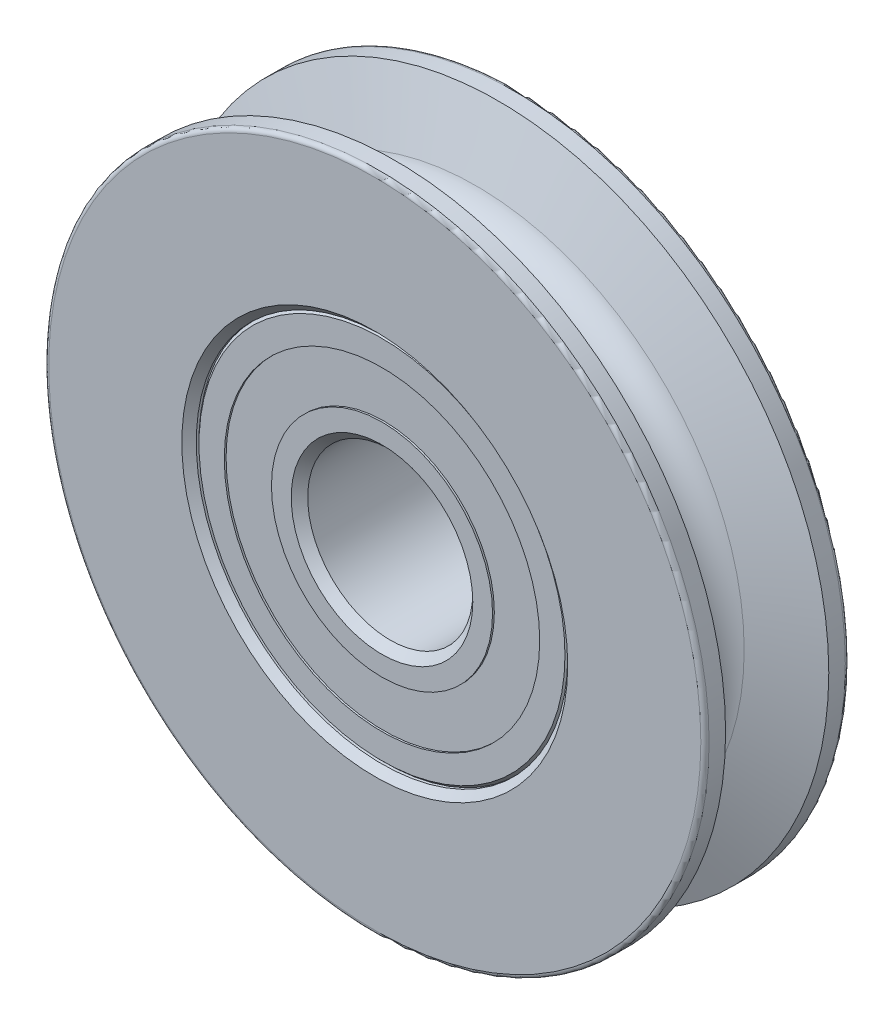
from build123d import *

# Parameters (mm, degrees)
BEARING_BALL_CIRPATTERN_COUNT = 11


with BuildPart() as part:
    # Sketch2 → Bushing Revolve1 (revolve)
    with BuildSketch(Plane(origin=(0, 0, 0), x_dir=(0, 0, -1), z_dir=(1, 0, 0))):
        with BuildLine():
            Line((-5.000625, 7.62), (-5.000625, 6.985))
            Line((-5.000625, 6.985), (-4.365625, 6.35))
            Line((-4.365625, 6.35), (4.683125, 6.35))
            Line((4.683125, 6.35), (5.000625, 6.6675))
            Line((5.000625, 6.6675), (5.000625, 8.504464286))
            Line((5.000625, 8.504464286), (1.360714286, 8.504464286))
            ThreePointArc((1.360714286, 8.504464286), (0.717159398, 8.167271806), (0, 8.050892857))
            Line((0, 8.050892857), (0, 6.985))
            Line((0, 6.985), (-4.365625, 6.985))
            Line((-4.365625, 6.985), (-5.000625, 7.62))
        make_face()
    revolve(axis=Axis((0, 0, 5.000625), (0, 0, -1)))



with BuildPart() as body_2:
    # Sketch3 → Bushing Revolve2 (revolve)
    with BuildSketch(Plane(origin=(0, 0, 0), x_dir=(0, 0, -1), z_dir=(1, 0, 0))):
        with BuildLine():
            Line((-5.000625, 8.504464286), (-5.000625, 7.62))
            Line((-5.000625, 7.62), (-4.365625, 6.985))
            Line((-4.365625, 6.985), (0, 6.985))
            Line((0, 6.985), (0, 8.050892857))
            ThreePointArc((0, 8.050892857), (-0.717159398, 8.167271806), (-1.360714286, 8.504464286))
            Line((-1.360714286, 8.504464286), (-5.000625, 8.504464286))
        make_face()
    revolve(axis=Axis((0, 0, 5.000625), (0, 0, -1)))


with BuildPart() as part_1:
    add(part.part)

    add(body_2.part)  # Bushing Revolve3 merges body 2
    # Sketch4 → Bushing Revolve3 (revolve)
    with BuildSketch(Plane(origin=(0, 0, 0), x_dir=(0, 0, -1), z_dir=(1, 0, 0))):
        with BuildLine():
            Line((1.360714286, 12.133035714), (5.000625, 12.133035714))
            Line((5.000625, 12.133035714), (5.000625, 14.075833333))
            Line((5.000625, 14.075833333), (4.788958333, 14.2875))
            Line((4.788958333, 14.2875), (-4.788958333, 14.2875))
            Line((-4.788958333, 14.2875), (-5.000625, 14.075833333))
            Line((-5.000625, 14.075833333), (-5.000625, 12.133035714))
            Line((-5.000625, 12.133035714), (-1.360714286, 12.133035714))
            ThreePointArc((-1.360714286, 12.133035714), (0, 12.586607143), (1.360714286, 12.133035714))
        make_face()
    revolve(axis=Axis((0, 0, 5.000625), (0, 0, -1)))


with BuildPart() as body_2_2:
    # Sketch5 → Shielding Revolve (revolve)
    with BuildSketch(Plane(origin=(0, 0, 0), x_dir=(0, 0, -1), z_dir=(1, 0, 0))):
        with BuildLine():
            Line((-4.86171875, 12.133035714), (-4.86171875, 8.504464286))
            Line((-4.86171875, 8.504464286), (-1.360714286, 8.504464286))
            ThreePointArc((-1.360714286, 8.504464286), (-2.267857143, 10.31875), (-1.360714286, 12.133035714))
            Line((-1.360714286, 12.133035714), (-4.86171875, 12.133035714))
        make_face()
        with BuildLine():
            Line((4.86171875, 8.504464286), (4.86171875, 12.133035714))
            Line((4.86171875, 12.133035714), (1.360714286, 12.133035714))
            ThreePointArc((1.360714286, 12.133035714), (2.267857143, 10.31875), (1.360714286, 8.504464286))
            Line((1.360714286, 8.504464286), (4.86171875, 8.504464286))
        make_face()
    revolve(axis=Axis((0, 0, 5.000625), (0, 0, -1)))


with BuildPart() as body_3:
    # Sketch6 → Sheave Revolve (revolve)
    with BuildSketch(Plane(origin=(0, 0, 0), x_dir=(0, 0, -1), z_dir=(1, 0, 0))):
        with BuildLine():
            Line((-5.23875, 25.4), (-3.96875, 25.4))
            Line((-3.96875, 25.4), (-2.239118959, 20.620881041))
            ThreePointArc((-2.239118959, 20.620881041), (0, 19.05), (2.239118959, 20.620881041))
            Line((2.239118959, 20.620881041), (3.96875, 25.4))
            Line((3.96875, 25.4), (5.23875, 25.4))
            ThreePointArc((5.23875, 25.4), (5.463256403, 25.307006403), (5.55625, 25.0825))
            Line((5.55625, 25.0825), (5.55625, 14.843125))
            Line((5.55625, 14.843125), (5.000625, 14.2875))
            Line((5.000625, 14.2875), (-5.000625, 14.2875))
            Line((-5.000625, 14.2875), (-5.55625, 14.843125))
            Line((-5.55625, 14.843125), (-5.55625, 25.0825))
            ThreePointArc((-5.55625, 25.0825), (-5.463256403, 25.307006403), (-5.23875, 25.4))
        make_face()
    revolve(axis=Axis((0, 0, 5.000625), (0, 0, -1)))


with BuildPart() as body_4:
    # Sketch7 → Bearing Ball Revolve (revolve)
    with BuildSketch(Plane(origin=(0, 0, 0), x_dir=(0, 0, -1), z_dir=(1, 0, 0))):
        with BuildLine():
            Line((-2.267857143, 10.31875), (2.267857143, 10.31875))
            ThreePointArc((2.267857143, 10.31875), (0, 12.586607143), (-2.267857143, 10.31875))
        make_face()
    revolve(axis=Axis((0, 10.31875, 2.267857143), (0, 0, -1)))


with BuildPart() as bearing_ball_cirpattern_1:
    # Bearing Ball CirPattern: pattern copy
    add(body_4.part.rotate(Axis((0, 0, 5.000625), (0, 0, -1)), 1 * 360 / BEARING_BALL_CIRPATTERN_COUNT))


with BuildPart() as bearing_ball_cirpattern_2:
    # Bearing Ball CirPattern: pattern copy
    add(body_4.part.rotate(Axis((0, 0, 5.000625), (0, 0, -1)), 2 * 360 / BEARING_BALL_CIRPATTERN_COUNT))


with BuildPart() as bearing_ball_cirpattern_3:
    # Bearing Ball CirPattern: pattern copy
    add(body_4.part.rotate(Axis((0, 0, 5.000625), (0, 0, -1)), 3 * 360 / BEARING_BALL_CIRPATTERN_COUNT))


with BuildPart() as bearing_ball_cirpattern_4:
    # Bearing Ball CirPattern: pattern copy
    add(body_4.part.rotate(Axis((0, 0, 5.000625), (0, 0, -1)), 4 * 360 / BEARING_BALL_CIRPATTERN_COUNT))


with BuildPart() as bearing_ball_cirpattern_5:
    # Bearing Ball CirPattern: pattern copy
    add(body_4.part.rotate(Axis((0, 0, 5.000625), (0, 0, -1)), 5 * 360 / BEARING_BALL_CIRPATTERN_COUNT))


with BuildPart() as bearing_ball_cirpattern_6:
    # Bearing Ball CirPattern: pattern copy
    add(body_4.part.rotate(Axis((0, 0, 5.000625), (0, 0, -1)), 6 * 360 / BEARING_BALL_CIRPATTERN_COUNT))


with BuildPart() as bearing_ball_cirpattern_7:
    # Bearing Ball CirPattern: pattern copy
    add(body_4.part.rotate(Axis((0, 0, 5.000625), (0, 0, -1)), 7 * 360 / BEARING_BALL_CIRPATTERN_COUNT))


with BuildPart() as bearing_ball_cirpattern_8:
    # Bearing Ball CirPattern: pattern copy
    add(body_4.part.rotate(Axis((0, 0, 5.000625), (0, 0, -1)), 8 * 360 / BEARING_BALL_CIRPATTERN_COUNT))


with BuildPart() as bearing_ball_cirpattern_9:
    # Bearing Ball CirPattern: pattern copy
    add(body_4.part.rotate(Axis((0, 0, 5.000625), (0, 0, -1)), 9 * 360 / BEARING_BALL_CIRPATTERN_COUNT))


with BuildPart() as bearing_ball_cirpattern_10:
    # Bearing Ball CirPattern: pattern copy
    add(body_4.part.rotate(Axis((0, 0, 5.000625), (0, 0, -1)), 10 * 360 / BEARING_BALL_CIRPATTERN_COUNT))


solid = Compound([part_1.part, body_2_2.part, body_3.part, body_4.part, bearing_ball_cirpattern_1.part, bearing_ball_cirpattern_2.part, bearing_ball_cirpattern_3.part, bearing_ball_cirpattern_4.part, bearing_ball_cirpattern_5.part, bearing_ball_cirpattern_6.part, bearing_ball_cirpattern_7.part, bearing_ball_cirpattern_8.part, bearing_ball_cirpattern_9.part, bearing_ball_cirpattern_10.part])
